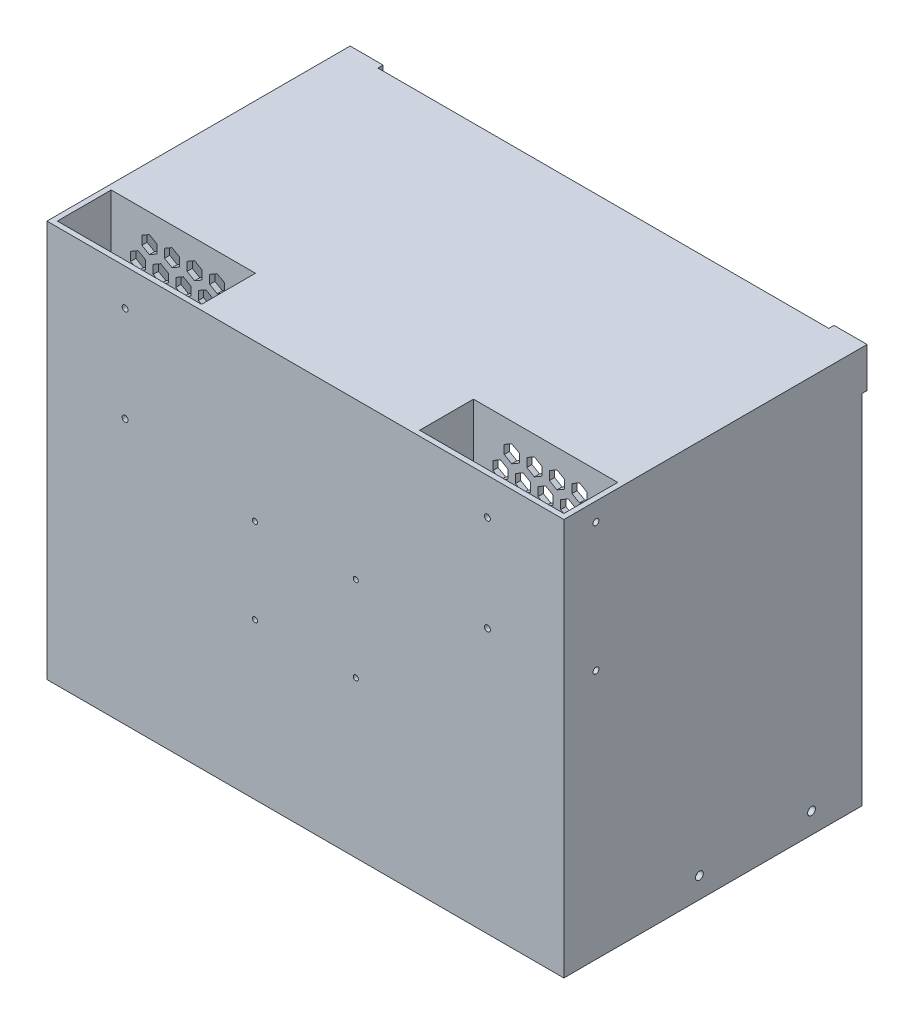
from build123d import *

# Parameters (mm, degrees)
SKETCH1_W                = 297.5
SKETCH1_H                = 228.5
BOSS_EXTRUDE1_DEPTH      = 171.5
SKETCH2_W                = 291.5
SKETCH2_H                = 225.5
CUT_EXTRUDE1_DEPTH       = 168.5
M4_CLEARANCE_HOLE1_D     = 4.5
SKETCH5_W                = 86
SKETCH5_H                = 100
BOSS_EXTRUDE2_DEPTH      = 34
SKETCH6_W                = 83
SKETCH6_H                = 31
CUT_EXTRUDE2_DEPTH       = 100
M3_CLEARANCE_HOLE1_D     = 3.4
M3_CLEARANCE_HOLE1_DEPTH = 3
M3_CLEARANCE_HOLE2_D     = 3.4
M3_CLEARANCE_HOLE2_DEPTH = 3
M3_CLEARANCE_HOLE3_D     = 3.4
M3_CLEARANCE_HOLE3_DEPTH = 3
SKETCH23_W               = 19
SKETCH23_H               = 23
BOSS_EXTRUDE3_DEPTH      = 3
M4_CLEARANCE_HOLE2_D     = 4.5
M4_CLEARANCE_HOLE2_DEPTH = 3
M2_5_CLEARANCE_HOLE1_D   = 2.9
CUT_EXTRUDE3_REACH       = 402.573
FILL_START               = 134.5
FILL_PATTERN1_DEPTH      = 3
CUT_EXTRUDE4_REACH       = 402.573
FILL_PATTERN2_DEPTH      = 3


# Read off the part's stored shape, not the designer's step: Fill Pattern1, Fill Pattern2
with BuildPart() as part:
    # Sketch1 → Boss-Extrude1 (new body)
    with BuildSketch(Plane.XY):
        with Locations((148.75, 114.25)):
            Rectangle(SKETCH1_W, SKETCH1_H)
    extrude(amount=BOSS_EXTRUDE1_DEPTH)

    # Sketch2 → Cut-Extrude1 (cut)
    with BuildSketch(Plane(origin=(0, 0, 0), x_dir=(-1, 0, 0), z_dir=(0, 0, -1))):
        with Locations((-148.75, 112.75)):
            Rectangle(SKETCH2_W, SKETCH2_H)
    extrude(amount=-CUT_EXTRUDE1_DEPTH, mode=Mode.SUBTRACT)

    # M4 Clearance Hole1 (through all)
    with Locations(Plane.ZY):
        with Locations((29, 12), (93.5, 12)):
            Hole(M4_CLEARANCE_HOLE1_D / 2)

    # Sketch5 → Boss-Extrude2 (add)
    with BuildSketch(Plane(origin=(0, 0, 168.5), x_dir=(-1, 0, 0), z_dir=(0, 0, -1))):
        with Locations((-251.5, 175.5)):
            Rectangle(SKETCH5_W, SKETCH5_H)
        with Locations((-46, 175.5)):
            Rectangle(SKETCH5_W, SKETCH5_H)
    extrude(amount=BOSS_EXTRUDE2_DEPTH)

    # Sketch6 → Cut-Extrude2 (cut)
    with BuildSketch(Plane(origin=(0, 228.5, 0), x_dir=(1, 0, 0), z_dir=(0, 1, 0))):
        with Locations((253, -153)):
            Rectangle(SKETCH6_W, SKETCH6_H)
        with Locations((44.5, -153)):
            Rectangle(SKETCH6_W, SKETCH6_H)
    extrude(amount=-CUT_EXTRUDE2_DEPTH, mode=Mode.SUBTRACT)

    # M3 Clearance Hole1
    with Locations(Plane.ZY.offset(-294.5)):
        with Locations((153, 218), (153, 144)):
            Hole(M3_CLEARANCE_HOLE1_D / 2, depth=M3_CLEARANCE_HOLE1_DEPTH)

    # M3 Clearance Hole2
    with Locations(Plane(origin=(0, 0, 168.5), x_dir=(-1, 0, 0), z_dir=(0, 0, -1))):
        with Locations((-45, 207.5), (-45, 152.5), (-253.5, 207.5), (-253.5, 152.269028534)):
            Hole(M3_CLEARANCE_HOLE2_D / 2, depth=M3_CLEARANCE_HOLE2_DEPTH)

    # M3 Clearance Hole3
    with Locations(Plane.ZY.offset(-86)):
        with Locations((153, 218), (153, 144)):
            Hole(M3_CLEARANCE_HOLE3_D / 2, depth=M3_CLEARANCE_HOLE3_DEPTH)

    # Sketch23 → Boss-Extrude3 (add)
    with BuildSketch(Plane(origin=(0, 0, 0), x_dir=(-1, 0, 0), z_dir=(0, 0, -1))):
        with Locations((-288, 217)):
            Rectangle(SKETCH23_W, SKETCH23_H)
        with Locations((-9.5, 217)):
            Rectangle(SKETCH23_W, SKETCH23_H)
    extrude(amount=BOSS_EXTRUDE3_DEPTH)

    # M4 Clearance Hole2
    with Locations(Plane(origin=(0, 0, -3), x_dir=(-1, 0, 0), z_dir=(0, 0, -1))):
        with Locations((-285.25, 214), (-12.25, 214)):
            Hole(M4_CLEARANCE_HOLE2_D / 2, depth=M4_CLEARANCE_HOLE2_DEPTH)

    # M2.5 Clearance Hole1 (through all)
    with Locations(Plane.XY.offset(171.5)):
        with Locations((119.749732738, 138.71488596), (119.749732738, 89.71488596), (177.749732738, 138.71488596), (177.749732738, 89.71488596)):
            Hole(M2_5_CLEARANCE_HOLE1_D / 2)

    # Sketch31 → Cut-Extrude3 (cut, up to next)
    with BuildSketch(Plane.XY.offset(137.5), mode=Mode.PRIVATE) as cut_extrude3_sk1:
        Polygon((48.830127019, 181), (44.5, 183.5), (40.169872981, 181), (40.169872981, 176), (44.5, 173.5), (48.830127019, 176), align=None)
    cut_extrude3_tool1 = extrude(cut_extrude3_sk1.sketch, amount=-CUT_EXTRUDE3_REACH, mode=Mode.PRIVATE) & part.part
    add(cut_extrude3_tool1.solids().sort_by_distance((44.5, 178.5, 137.5))[0], mode=Mode.SUBTRACT)

    # Fill Pattern1 outline → Fill Pattern1 (cut)
    with BuildSketch(Plane.XY.offset(FILL_START)):
        Polygon((44.5, 150.990668602), (48.830127019, 153.490668602), (48.830127019, 158.490668602), (44.5, 160.990668602), (40.169872981, 158.490668602), (40.169872981, 153.490668602), align=None)
        Polygon((44.5, 196.009331398), (48.830127019, 198.509331398), (48.830127019, 203.509331398), (44.5, 206.009331398), (40.169872981, 203.509331398), (40.169872981, 198.509331398), align=None)
        Polygon((20.676220168, 164.745334301), (25.006347187, 162.245334301), (29.336474206, 164.745334301), (29.336474206, 169.745334301), (25.006347187, 172.245334301), (20.676220168, 169.745334301), align=None)
        Polygon((59.663525794, 187.254665699), (63.993652813, 184.754665699), (68.323779832, 187.254665699), (68.323779832, 192.254665699), (63.993652813, 194.754665699), (59.663525794, 192.254665699), align=None)
        Polygon((20.676220168, 192.254665699), (20.676220168, 187.254665699), (25.006347187, 184.754665699), (29.336474206, 187.254665699), (29.336474206, 192.254665699), (25.006347187, 194.754665699), align=None)
        Polygon((59.663525794, 169.745334301), (59.663525794, 164.745334301), (63.993652813, 162.245334301), (68.323779832, 164.745334301), (68.323779832, 169.745334301), (63.993652813, 172.245334301), align=None)
        Polygon((70.491537084, 196.009331398), (74.821664103, 198.509331398), (74.821664103, 203.509331398), (70.491537084, 206.009331398), (66.161410065, 203.509331398), (66.161410065, 198.509331398), align=None)
        Polygon((70.491537084, 150.990668602), (74.821664103, 153.490668602), (74.821664103, 158.490668602), (70.491537084, 160.990668602), (66.161410065, 158.490668602), (66.161410065, 153.490668602), align=None)
        Polygon((70.491537084, 173.5), (74.821664103, 176), (74.821664103, 181), (70.491537084, 183.5), (66.161410065, 181), (66.161410065, 176), align=None)
        Polygon((27.174104439, 176), (31.504231458, 173.5), (35.834358477, 176), (35.834358477, 181), (31.504231458, 183.5), (27.174104439, 181), align=None)
        Polygon((46.667757252, 187.254665699), (50.997884271, 184.754665699), (55.32801129, 187.254665699), (55.32801129, 192.254665699), (50.997884271, 194.754665699), (46.667757252, 192.254665699), align=None)
        Polygon((46.667757252, 214.763997098), (46.667757252, 209.763997098), (50.997884271, 207.263997098), (55.32801129, 209.763997097), (55.32801129, 214.763997098), (50.997884271, 217.263997098), align=None)
        Polygon((31.504231458, 150.990668602), (35.834358477, 153.490668602), (35.834358477, 158.490668602), (31.504231458, 160.990668602), (27.174104439, 158.490668602), (27.174104439, 153.490668602), align=None)
        Polygon((31.504231458, 196.009331398), (35.834358477, 198.509331398), (35.834358477, 203.509331398), (31.504231458, 206.009331398), (27.174104439, 203.509331398), (27.174104439, 198.509331398), align=None)
        Polygon((46.667757252, 169.745334301), (46.667757252, 164.745334301), (50.997884271, 162.245334301), (55.32801129, 164.745334301), (55.32801129, 169.745334301), (50.997884271, 172.245334301), align=None)
        Polygon((25.006347187, 207.263997098), (29.336474206, 209.763997097), (29.336474206, 214.763997098), (25.006347187, 217.263997098), (20.676220168, 214.763997097), (20.676220168, 209.763997098), align=None)
        Polygon((25.006347187, 139.736002902), (29.336474206, 142.236002902), (29.336474206, 147.236002902), (25.006347187, 149.736002902), (20.676220168, 147.236002902), (20.676220168, 142.236002902), align=None)
        Polygon((59.663525794, 209.763997098), (63.993652813, 207.263997098), (68.323779832, 209.763997097), (68.323779832, 214.763997098), (63.993652813, 217.263997098), (59.663525794, 214.763997097), align=None)
        Polygon((18.508462916, 196.009331398), (22.838589935, 198.509331398), (22.838589935, 203.509331398), (18.508462916, 206.009331398), (14.178335897, 203.509331398), (14.178335897, 198.509331398), align=None)
        Polygon((18.508462916, 150.990668602), (22.838589935, 153.490668602), (22.838589935, 158.490668602), (18.508462916, 160.990668602), (14.178335897, 158.490668602), (14.178335897, 153.490668602), align=None)
        Polygon((18.508462916, 173.5), (22.838589935, 176), (22.838589935, 181), (18.508462916, 183.5), (14.178335897, 181), (14.178335897, 176), align=None)
        Polygon((33.67198871, 209.763997098), (38.002115729, 207.263997098), (42.332242748, 209.763997097), (42.332242748, 214.763997098), (38.002115729, 217.263997098), (33.67198871, 214.763997097), align=None)
        Polygon((53.165641523, 181), (53.165641523, 176), (57.495768542, 173.5), (61.825895561, 176), (61.825895561, 181), (57.495768542, 183.5), align=None)
        Polygon((33.67198871, 192.254665699), (33.67198871, 187.254665699), (38.002115729, 184.754665699), (42.332242748, 187.254665699), (42.332242748, 192.254665699), (38.002115729, 194.754665699), align=None)
        Polygon((38.002115729, 139.736002902), (42.332242748, 142.236002902), (42.332242748, 147.236002902), (38.002115729, 149.736002902), (33.67198871, 147.236002902), (33.67198871, 142.236002902), align=None)
        Polygon((38.002115729, 162.245334301), (42.332242748, 164.745334301), (42.332242748, 169.745334301), (38.002115729, 172.245334301), (33.67198871, 169.745334301), (33.67198871, 164.745334301), align=None)
        Polygon((53.165641523, 153.490668602), (57.495768542, 150.990668602), (61.825895561, 153.490668602), (61.825895561, 158.490668602), (57.495768542, 160.990668602), (53.165641523, 158.490668602), align=None)
        Polygon((50.997884271, 139.736002902), (55.32801129, 142.236002902), (55.32801129, 147.236002902), (50.997884271, 149.736002902), (46.667757252, 147.236002902), (46.667757252, 142.236002902), align=None)
        Polygon((59.663525794, 147.236002902), (59.663525794, 142.236002902), (63.993652813, 139.736002903), (68.323779832, 142.236002902), (68.323779832, 147.236002902), (63.993652813, 149.736002903), align=None)
        Polygon((53.165641523, 198.509331398), (57.495768542, 196.009331398), (61.825895561, 198.509331398), (61.825895561, 203.509331398), (57.495768542, 206.009331398), (53.165641523, 203.509331398), align=None)
    extrude(amount=FILL_PATTERN1_DEPTH, mode=Mode.SUBTRACT)

    # Sketch32 → Cut-Extrude4 (cut, up to next)
    with BuildSketch(Plane.XY.offset(137.5), mode=Mode.PRIVATE) as cut_extrude4_sk1:
        Polygon((257.330127019, 181), (253, 183.5), (248.669872981, 181), (248.669872981, 176), (253, 173.5), (257.330127019, 176), align=None)
    cut_extrude4_tool1 = extrude(cut_extrude4_sk1.sketch, amount=-CUT_EXTRUDE4_REACH, mode=Mode.PRIVATE) & part.part
    add(cut_extrude4_tool1.solids().sort_by_distance((253, 178.5, 137.5))[0], mode=Mode.SUBTRACT)

    # Fill Pattern2 outline → Fill Pattern2 (cut)
    with BuildSketch(Plane.XY.offset(FILL_START)):
        Polygon((253, 150.990668602), (257.330127019, 153.490668602), (257.330127019, 158.490668602), (253, 160.990668602), (248.669872981, 158.490668602), (248.669872981, 153.490668602), align=None)
        Polygon((253, 196.009331398), (257.330127019, 198.509331398), (257.330127019, 203.509331398), (253, 206.009331398), (248.669872981, 203.509331398), (248.669872981, 198.509331398), align=None)
        Polygon((229.176220168, 164.745334301), (233.506347187, 162.245334301), (237.836474206, 164.745334301), (237.836474206, 169.745334301), (233.506347187, 172.245334301), (229.176220168, 169.745334301), align=None)
        Polygon((268.163525794, 187.254665699), (272.493652813, 184.754665699), (276.823779832, 187.254665699), (276.823779832, 192.254665699), (272.493652813, 194.754665699), (268.163525794, 192.254665699), align=None)
        Polygon((229.176220168, 192.254665699), (229.176220168, 187.254665699), (233.506347187, 184.754665699), (237.836474206, 187.254665699), (237.836474206, 192.254665699), (233.506347187, 194.754665699), align=None)
        Polygon((268.163525794, 169.745334301), (268.163525794, 164.745334301), (272.493652813, 162.245334301), (276.823779832, 164.745334301), (276.823779832, 169.745334301), (272.493652813, 172.245334301), align=None)
        Polygon((283.321664103, 203.509331398), (278.991537084, 206.009331398), (274.661410065, 203.509331398), (274.661410065, 198.509331398), (278.991537084, 196.009331398), (283.321664103, 198.509331398), align=None)
        Polygon((244.334358477, 181), (240.004231458, 183.5), (235.674104439, 181), (235.674104439, 176), (240.004231458, 173.5), (244.334358477, 176), align=None)
        Polygon((263.82801129, 192.254665699), (259.497884271, 194.754665699), (255.167757252, 192.254665699), (255.167757252, 187.254665699), (259.497884271, 184.754665699), (263.82801129, 187.254665699), align=None)
        Polygon((263.82801129, 209.763997098), (263.82801129, 214.763997098), (259.497884271, 217.263997097), (255.167757252, 214.763997098), (255.167757252, 209.763997098), (259.497884271, 207.263997098), align=None)
        Polygon((278.991537084, 150.990668602), (283.321664103, 153.490668602), (283.321664103, 158.490668602), (278.991537084, 160.990668602), (274.661410065, 158.490668602), (274.661410065, 153.490668602), align=None)
        Polygon((278.991537084, 173.5), (283.321664103, 176), (283.321664103, 181), (278.991537084, 183.5), (274.661410065, 181), (274.661410065, 176), align=None)
        Polygon((240.004231458, 150.990668602), (244.334358477, 153.490668602), (244.334358477, 158.490668602), (240.004231458, 160.990668602), (235.674104439, 158.490668602), (235.674104439, 153.490668602), align=None)
        Polygon((240.004231458, 196.009331398), (244.334358477, 198.509331398), (244.334358477, 203.509331398), (240.004231458, 206.009331398), (235.674104439, 203.509331398), (235.674104439, 198.509331398), align=None)
        Polygon((255.167757252, 169.745334301), (255.167757252, 164.745334301), (259.497884271, 162.245334301), (263.82801129, 164.745334301), (263.82801129, 169.745334301), (259.497884271, 172.245334301), align=None)
        Polygon((233.506347187, 207.263997098), (237.836474206, 209.763997098), (237.836474206, 214.763997098), (233.506347187, 217.263997097), (229.176220168, 214.763997097), (229.176220168, 209.763997098), align=None)
        Polygon((233.506347187, 139.736002902), (237.836474206, 142.236002903), (237.836474206, 147.236002902), (233.506347187, 149.736002902), (229.176220168, 147.236002902), (229.176220168, 142.236002902), align=None)
        Polygon((268.163525794, 209.763997098), (272.493652813, 207.263997098), (276.823779832, 209.763997098), (276.823779832, 214.763997098), (272.493652813, 217.263997098), (268.163525794, 214.763997098), align=None)
        Polygon((227.008462916, 196.009331398), (231.338589935, 198.509331398), (231.338589935, 203.509331398), (227.008462916, 206.009331398), (222.678335897, 203.509331398), (222.678335897, 198.509331398), align=None)
        Polygon((227.008462916, 150.990668602), (231.338589935, 153.490668602), (231.338589935, 158.490668602), (227.008462916, 160.990668602), (222.678335897, 158.490668602), (222.678335897, 153.490668602), align=None)
        Polygon((227.008462916, 173.5), (231.338589935, 176), (231.338589935, 181), (227.008462916, 183.5), (222.678335897, 181), (222.678335897, 176), align=None)
        Polygon((242.17198871, 209.763997098), (246.502115729, 207.263997097), (250.832242748, 209.763997097), (250.832242748, 214.763997098), (246.502115729, 217.263997097), (242.17198871, 214.763997098), align=None)
        Polygon((261.665641523, 181), (261.665641523, 176), (265.995768542, 173.5), (270.325895561, 176), (270.325895561, 181), (265.995768542, 183.5), align=None)
        Polygon((242.17198871, 192.254665699), (242.17198871, 187.254665699), (246.502115729, 184.754665699), (250.832242748, 187.254665699), (250.832242748, 192.254665699), (246.502115729, 194.754665699), align=None)
        Polygon((246.502115729, 139.736002902), (250.832242748, 142.236002902), (250.832242748, 147.236002902), (246.502115729, 149.736002902), (242.17198871, 147.236002903), (242.17198871, 142.236002902), align=None)
        Polygon((246.502115729, 162.245334301), (250.832242748, 164.745334301), (250.832242748, 169.745334301), (246.502115729, 172.245334301), (242.17198871, 169.745334301), (242.17198871, 164.745334301), align=None)
        Polygon((261.665641523, 153.490668602), (265.995768542, 150.990668602), (270.325895561, 153.490668602), (270.325895561, 158.490668602), (265.995768542, 160.990668602), (261.665641523, 158.490668602), align=None)
        Polygon((259.497884271, 139.736002902), (263.82801129, 142.236002902), (263.82801129, 147.236002902), (259.497884271, 149.736002902), (255.167757252, 147.236002903), (255.167757252, 142.236002902), align=None)
        Polygon((268.163525794, 147.236002902), (268.163525794, 142.236002902), (272.493652813, 139.736002902), (276.823779832, 142.236002902), (276.823779832, 147.236002902), (272.493652813, 149.736002902), align=None)
        Polygon((261.665641523, 198.509331398), (265.995768542, 196.009331398), (270.325895561, 198.509331398), (270.325895561, 203.509331398), (265.995768542, 206.009331398), (261.665641523, 203.509331398), align=None)
    extrude(amount=FILL_PATTERN2_DEPTH, mode=Mode.SUBTRACT)


solid = part.part
